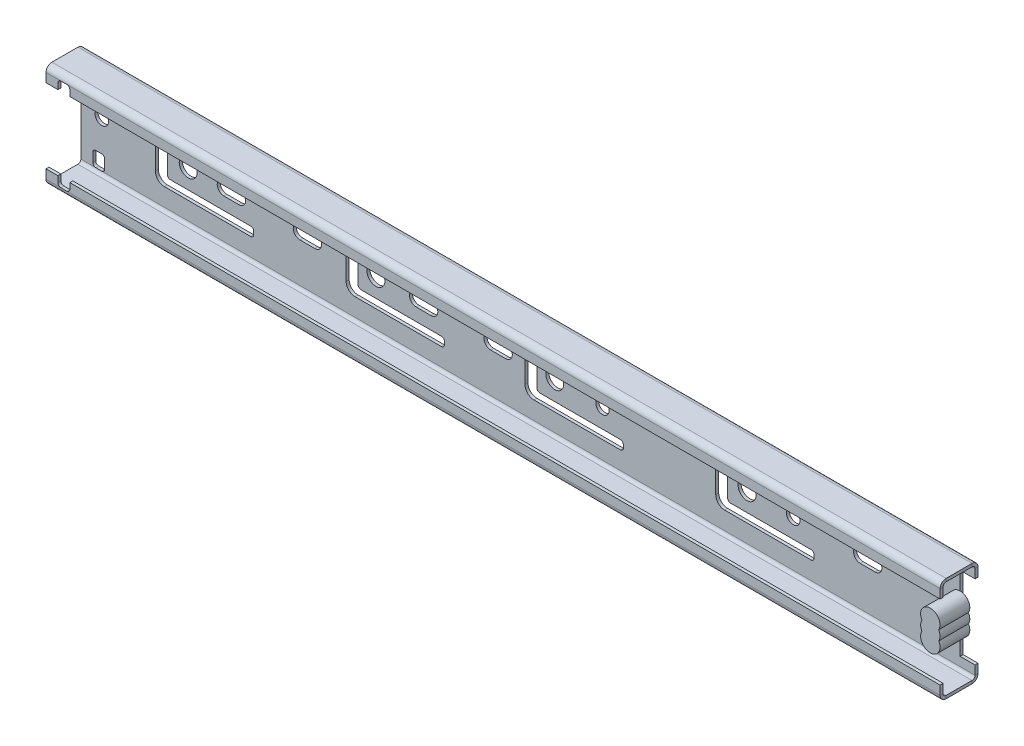
from build123d import *

# Parameters (mm, degrees)
BASE_FLANGE1_DEPTH       = 300
SKETCH6_W                = 10
SKETCH6_H                = 25
CUT_EXTRUDE1_DEPTH       = 301.737659763
ESBO_O1_R                = 2.25
ESBO_O1_R_2              = 3
CORTE_EXTRUS_O1_DEPTH    = 301.778223946
RESSALTO_EXTRUS_O1_DEPTH = 10


# Sheet-metal steps are written as plain solids
with BuildPart() as part:
    # Sketch1 → Base-Flange1 (new body)
    with BuildSketch(Plane(origin=(0, 0, 0), x_dir=(0, 0, -1), z_dir=(1, 0, 0))):
        with BuildLine():
            Line((-12.7, -12.5), (-12.7, -15.5))
            ThreePointArc((-12.7, -15.5), (-12.114213562, -16.914213562), (-10.7, -17.5))
            Line((-10.7, -17.5), (-2, -17.5))
            ThreePointArc((-2, -17.5), (-0.585786438, -16.914213562), (0, -15.5))
            Line((0, -15.5), (0, 15.5))
            ThreePointArc((0, 15.5), (-0.585786438, 16.914213562), (-2, 17.5))
            Line((-2, 17.5), (-10.7, 17.5))
            ThreePointArc((-10.7, 17.5), (-12.114213562, 16.914213562), (-12.7, 15.5))
            Line((-12.7, 15.5), (-12.7, 12.5))
            Line((-12.7, 12.5), (-11.7, 12.5))
            Line((-11.7, 12.5), (-11.7, 15.5))
            ThreePointArc((-11.7, 15.5), (-11.407106781, 16.207106781), (-10.7, 16.5))
            Line((-10.7, 16.5), (-2, 16.5))
            ThreePointArc((-2, 16.5), (-1.292893219, 16.207106781), (-1, 15.5))
            Line((-1, 15.5), (-1, -15.5))
            ThreePointArc((-1, -15.5), (-1.292893219, -16.207106781), (-2, -16.5))
            Line((-2, -16.5), (-10.7, -16.5))
            ThreePointArc((-10.7, -16.5), (-11.407106781, -16.207106781), (-11.7, -15.5))
            Line((-11.7, -15.5), (-11.7, -12.5))
            Line((-11.7, -12.5), (-12.7, -12.5))
        make_face()
    extrude(amount=-BASE_FLANGE1_DEPTH)

    # Sketch6 → Cut-Extrude1 (cut, through all)
    with BuildSketch(Plane.XY.offset(1)):
        Rectangle(SKETCH6_W, SKETCH6_H)
    extrude(amount=-CUT_EXTRUDE1_DEPTH, mode=Mode.SUBTRACT)

    # Esboço1 → Corte-extrusão1 (cut, through all)
    with BuildSketch(Plane(origin=(0, 0, 0), x_dir=(-1, 0, 0), z_dir=(0, 0, -1))):
        with Locations(Location((61, 0, 0), (0, 0, 90))):
            Circle(ESBO_O1_R)
        with Locations(Location((76.5, 0, 0), (0, 0, 90))):
            Circle(ESBO_O1_R_2)
        with Locations(Location((125, 0, 0), (0, 0, 90))):
            Circle(ESBO_O1_R)
        with Locations(Location((141, 0, 0), (0, 0, 90))):
            Circle(ESBO_O1_R_2)
        with Locations(Location((201, 0, 0), (0, 0, 90))):
            Circle(ESBO_O1_R_2)
        with Locations(Location((264, 0, 0), (0, 0, 90))):
            Circle(ESBO_O1_R_2)
        with Locations(Location((293, 0, 0), (0, 0, 90))):
            Circle(ESBO_O1_R)
        with BuildLine():
            Line((33.5, 2.25), (38.5, 2.25))
            ThreePointArc((38.5, 2.25), (40.75, 0), (38.5, -2.25))
            Line((38.5, -2.25), (33.5, -2.25))
            ThreePointArc((33.5, -2.25), (31.25, 0), (33.5, 2.25))
        make_face()
        with BuildLine():
            Line((182.5, 2.25), (187.5, 2.25))
            ThreePointArc((187.5, 2.25), (189.75, 0), (187.5, -2.25))
            Line((187.5, -2.25), (182.5, -2.25))
            ThreePointArc((182.5, -2.25), (180.25, 0), (182.5, 2.25))
        make_face()
        with BuildLine():
            Line((247, 2.25), (252, 2.25))
            ThreePointArc((252, 2.25), (254.25, 0), (252, -2.25))
            Line((252, -2.25), (247, -2.25))
            ThreePointArc((247, -2.25), (244.75, 0), (247, 2.25))
        make_face()
        with BuildLine():
            Line((221.5, 2.25), (226.5, 2.25))
            ThreePointArc((226.5, 2.25), (228.75, 0), (226.5, -2.25))
            Line((226.5, -2.25), (221.5, -2.25))
            ThreePointArc((221.5, -2.25), (219.25, 0), (221.5, 2.25))
        make_face()
        with BuildLine():
            Line((157.5, 2.25), (162.5, 2.25))
            ThreePointArc((162.5, 2.25), (164.75, 0), (162.5, -2.25))
            Line((162.5, -2.25), (157.5, -2.25))
            ThreePointArc((157.5, -2.25), (155.25, 0), (157.5, 2.25))
        make_face()
        with BuildLine():
            Line((55, 9.5), (84, 9.5))
            ThreePointArc((84, 9.5), (86.121320344, 8.621320344), (87, 6.5))
            Line((87, 6.5), (87, -6.5))
            ThreePointArc((87, -6.5), (86.121320344, -8.621320344), (84, -9.5))
            Line((84, -9.5), (55, -9.5))
            ThreePointArc((55, -9.5), (54.292893219, -9.207106781), (54, -8.5))
            Line((54, -8.5), (54, -7.5))
            ThreePointArc((54, -7.5), (54.292893219, -6.792893219), (55, -6.5))
            Line((55, -6.5), (82, -6.5))
            ThreePointArc((82, -6.5), (82.707106781, -6.207106781), (83, -5.5))
            Line((83, -5.5), (83, 5.5))
            ThreePointArc((83, 5.5), (82.707106781, 6.207106781), (82, 6.5))
            Line((82, 6.5), (55, 6.5))
            ThreePointArc((55, 6.5), (54.292893219, 6.792893219), (54, 7.5))
            Line((54, 7.5), (54, 8.5))
            ThreePointArc((54, 8.5), (54.292893219, 9.207106781), (55, 9.5))
        make_face()
        with BuildLine():
            Line((119, 9.5), (148, 9.5))
            ThreePointArc((148, 9.5), (150.121320344, 8.621320344), (151, 6.5))
            Line((151, 6.5), (151, -6.5))
            ThreePointArc((151, -6.5), (150.121320344, -8.621320344), (148, -9.5))
            Line((148, -9.5), (119, -9.5))
            ThreePointArc((119, -9.5), (118.292893219, -9.207106781), (118, -8.5))
            Line((118, -8.5), (118, -7.5))
            ThreePointArc((118, -7.5), (118.292893219, -6.792893219), (119, -6.5))
            Line((119, -6.5), (146, -6.5))
            ThreePointArc((146, -6.5), (146.707106781, -6.207106781), (147, -5.5))
            Line((147, -5.5), (147, 5.5))
            ThreePointArc((147, 5.5), (146.707106781, 6.207106781), (146, 6.5))
            Line((146, 6.5), (119, 6.5))
            ThreePointArc((119, 6.5), (118.292893219, 6.792893219), (118, 7.5))
            Line((118, 7.5), (118, 8.5))
            ThreePointArc((118, 8.5), (118.292893219, 9.207106781), (119, 9.5))
        make_face()
        with BuildLine():
            Line((179, 9.5), (208, 9.5))
            ThreePointArc((208, 9.5), (210.121320344, 8.621320344), (211, 6.5))
            Line((211, 6.5), (211, -6.5))
            ThreePointArc((211, -6.5), (210.121320344, -8.621320344), (208, -9.5))
            Line((208, -9.5), (179, -9.5))
            ThreePointArc((179, -9.5), (178.292893219, -9.207106781), (178, -8.5))
            Line((178, -8.5), (178, -7.501700086))
            ThreePointArc((178, -7.501700086), (178.292893219, -6.794593304), (179, -6.501700086))
            Line((179, -6.501700086), (206, -6.501700086))
            ThreePointArc((206, -6.501700086), (206.707106781, -6.208806867), (207, -5.501700086))
            Line((207, -5.501700086), (207, 5.501700086))
            ThreePointArc((207, 5.501700086), (206.707106781, 6.208806867), (206, 6.501700086))
            Line((206, 6.501700086), (179, 6.501700086))
            ThreePointArc((179, 6.501700086), (178.292893219, 6.794593304), (178, 7.501700086))
            Line((178, 7.501700086), (178, 8.5))
            ThreePointArc((178, 8.5), (178.292893219, 9.207106781), (179, 9.5))
        make_face()
        with BuildLine():
            Line((243, 9.5), (272, 9.5))
            ThreePointArc((272, 9.5), (274.121320344, 8.621320344), (275, 6.5))
            Line((275, 6.5), (275, -6.5))
            ThreePointArc((275, -6.5), (274.121320344, -8.621320344), (272, -9.5))
            Line((272, -9.5), (243, -9.5))
            ThreePointArc((243, -9.5), (242.292893219, -9.207106781), (242, -8.5))
            Line((242, -8.5), (242, -7.501700086))
            ThreePointArc((242, -7.501700086), (242.292893219, -6.794593304), (243, -6.501700086))
            Line((243, -6.501700086), (270, -6.501700086))
            ThreePointArc((270, -6.501700086), (270.707106781, -6.208806867), (271, -5.501700086))
            Line((271, -5.501700086), (271, 5.501700086))
            ThreePointArc((271, 5.501700086), (270.707106781, 6.208806867), (270, 6.501700086))
            Line((270, 6.501700086), (243, 6.501700086))
            ThreePointArc((243, 6.501700086), (242.292893219, 6.794593304), (242, 7.501700086))
            Line((242, 7.501700086), (242, 8.5))
            ThreePointArc((242, 8.5), (242.292893219, 9.207106781), (243, 9.5))
        make_face()
        with BuildLine():
            Line((293, 15.5), (295, 15.5))
            ThreePointArc((295, 15.5), (295.707106781, 15.207106781), (296, 14.5))
            Line((296, 14.5), (296, 11.5))
            ThreePointArc((296, 11.5), (295.707106781, 10.792893219), (295, 10.5))
            Line((295, 10.5), (293, 10.5))
            ThreePointArc((293, 10.5), (292.292893219, 10.792893219), (292, 11.5))
            Line((292, 11.5), (292, 14.5))
            ThreePointArc((292, 14.5), (292.292893219, 15.207106781), (293, 15.5))
        make_face()
        with BuildLine():
            Line((293, -15.5), (295, -15.5))
            ThreePointArc((295, -15.5), (295.707106781, -15.207106781), (296, -14.5))
            Line((296, -14.5), (296, -11.5))
            ThreePointArc((296, -11.5), (295.707106781, -10.792893219), (295, -10.5))
            Line((295, -10.5), (293, -10.5))
            ThreePointArc((293, -10.5), (292.292893219, -10.792893219), (292, -11.5))
            Line((292, -11.5), (292, -14.5))
            ThreePointArc((292, -14.5), (292.292893219, -15.207106781), (293, -15.5))
        make_face()
    extrude(amount=-CORTE_EXTRUS_O1_DEPTH, mode=Mode.SUBTRACT)

    # Esboço2 → Ressalto-extrusão1 (add)
    with BuildSketch(Plane.XY.offset(1)):
        with BuildLine():
            ThreePointArc((-7.814582562, 1.625), (-8.25, 0), (-7.814582562, -1.625))
            ThreePointArc((-7.814582562, -1.625), (-5, -6.5), (-2.185417438, -1.625))
            ThreePointArc((-2.185417438, -1.625), (-1.75, 0), (-2.185417438, 1.625))
            ThreePointArc((-2.185417438, 1.625), (-5, 6.5), (-7.814582562, 1.625))
        make_face()
    extrude(amount=RESSALTO_EXTRUS_O1_DEPTH)


solid = part.part
